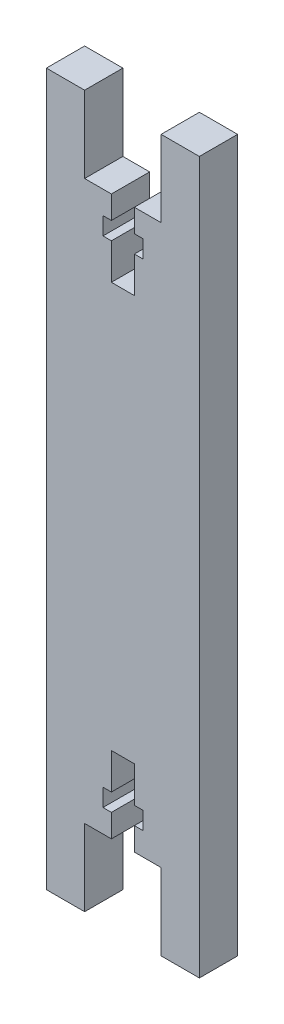
from build123d import *

# Parameters (mm, degrees)
BOSS_EXTRUDE1_DEPTH = 5


with BuildPart() as part:
    # Sketch1 → Boss-Extrude1 (new body)
    with BuildSketch(Plane.XY):
        Polygon((-1.5, 0), (-5, 0), (-5, -10), (-10, -10), (-10, 0), (-10, 75), (-10, 78), (-10, 83), (-5, 83), (-5, 78), (-5, 73), (-1.5, 73), (-1.5, 70), (-2.6, 70), (-2.6, 67.7), (-1.5, 67.7), (-1.5, 63), (1.5, 63), (1.5, 67.7), (2.6, 67.7), (2.6, 70), (1.5, 70), (1.5, 73), (5, 73), (5, 78), (5, 83), (10, 83), (10, 80), (10, 0), (10, -10), (5, -10), (5, 0), (1.5, 0), (1.5, 3), (2.6, 3), (2.6, 5.3), (1.5, 5.3), (1.5, 10), (-1.5, 10), (-1.5, 5.3), (-2.6, 5.3), (-2.6, 3), (-1.5, 3), align=None)
    extrude(amount=BOSS_EXTRUDE1_DEPTH)


solid = part.part
